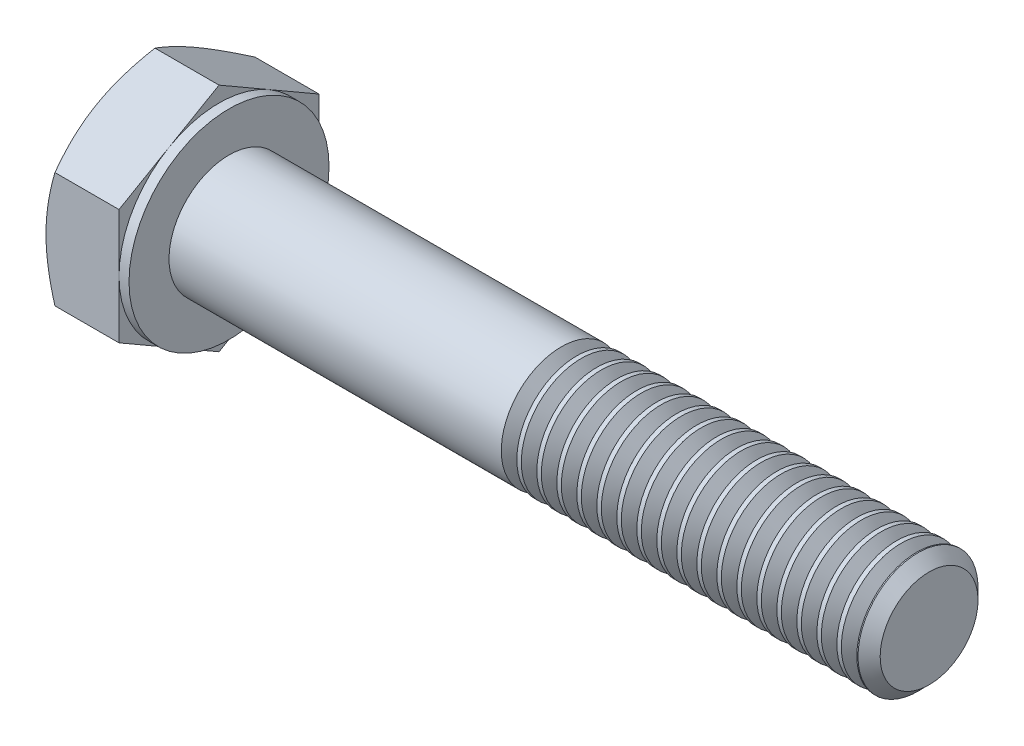
from build123d import *

# Parameters (mm, degrees)
BASEHEAD_DEPTH     = 4.15
INDENT_START       = -0.51875
INDENT_2_OUTLINE_R = 4.375
INDENT_2_DEPTH     = 0.51875
SKETCH4_W          = 0.5
SKETCH4_H          = 10.773502692
THDSCHPAT_COUNT    = 18
THDSCHPAT_PITCH    = 1


# Read off the part's stored shape, not the designer's step: Indent
with BuildPart() as part:
    # Sketch1 → BaseHead (new body)
    with BuildSketch(Plane(origin=(0, 0, 0), x_dir=(0, 0, -1), z_dir=(1, 0, 0))):
        Polygon((5, 2.886751346), (5, -2.886751346), (0, -5.773502692), (-5, -2.886751346), (-5, 2.886751346), (0, 5.773502692), align=None)
    extrude(amount=BASEHEAD_DEPTH)

    # Indent outline → Indent (revolve)
    with BuildSketch(Plane.YX):
        Polygon((3, 4.15), (3, 38.5955), (2.4455, 39.15), (0, 39.15), (0, 4.15), align=None)
    revolve(axis=Axis((0, 0, 0), (1, 0, 0)))

    # Indent 2 outline → Indent 2 (cut)
    with BuildSketch(Plane.ZY.offset(INDENT_START)):
        with Locations((0.033212245, 0.192376607)):
            Circle(INDENT_2_OUTLINE_R)
    extrude(amount=INDENT_2_DEPTH, mode=Mode.SUBTRACT)

    # Sketch3 → HeadChamfer (revolve, cut)
    with BuildSketch(Plane.XY, mode=Mode.PRIVATE) as headchamfer_sk:
        Polygon((0, 5), (3.333333333, 10.773502692), (3.333333333, 15.773502692), (-10, 15.773502692), (-10, 5), align=None)
    revolve(headchamfer_sk.sketch.rotate(Axis((0, 0, 0), (1, 0, 0)), 90), axis=Axis((0, 0, 0), (1, 0, 0)), mode=Mode.SUBTRACT)

    # Sketch4 → BearingFace (revolve, cut)
    with BuildSketch(Plane.XY, mode=Mode.PRIVATE) as bearingface_sk:
        with Locations((3.9, 10.386751346)):
            Rectangle(SKETCH4_W, SKETCH4_H)
    revolve(bearingface_sk.sketch.rotate(Axis((0, 0, 0), (1, 0, 0)), 90), axis=Axis((0, 0, 0), (1, 0, 0)), mode=Mode.SUBTRACT)

    # ThdSchSke → ThreadSchematic (revolve, cut)
    with BuildSketch(Plane.XY):
        Polygon((21.15, -2.4455), (20.76173492, -3), (20.76173492, -3.75), (21.53826508, -3.75), (21.53826508, -3), align=None)
    threadschematic = revolve(axis=Axis((-3.175, 0, 0), (1, 0, 0)), mode=Mode.SUBTRACT)

    # ThdSchPat: ThreadSchematic ×18
    with Locations(*[(i * THDSCHPAT_PITCH, 0, 0) for i in range(1, THDSCHPAT_COUNT)]):
        add(threadschematic, mode=Mode.SUBTRACT)


solid = part.part
